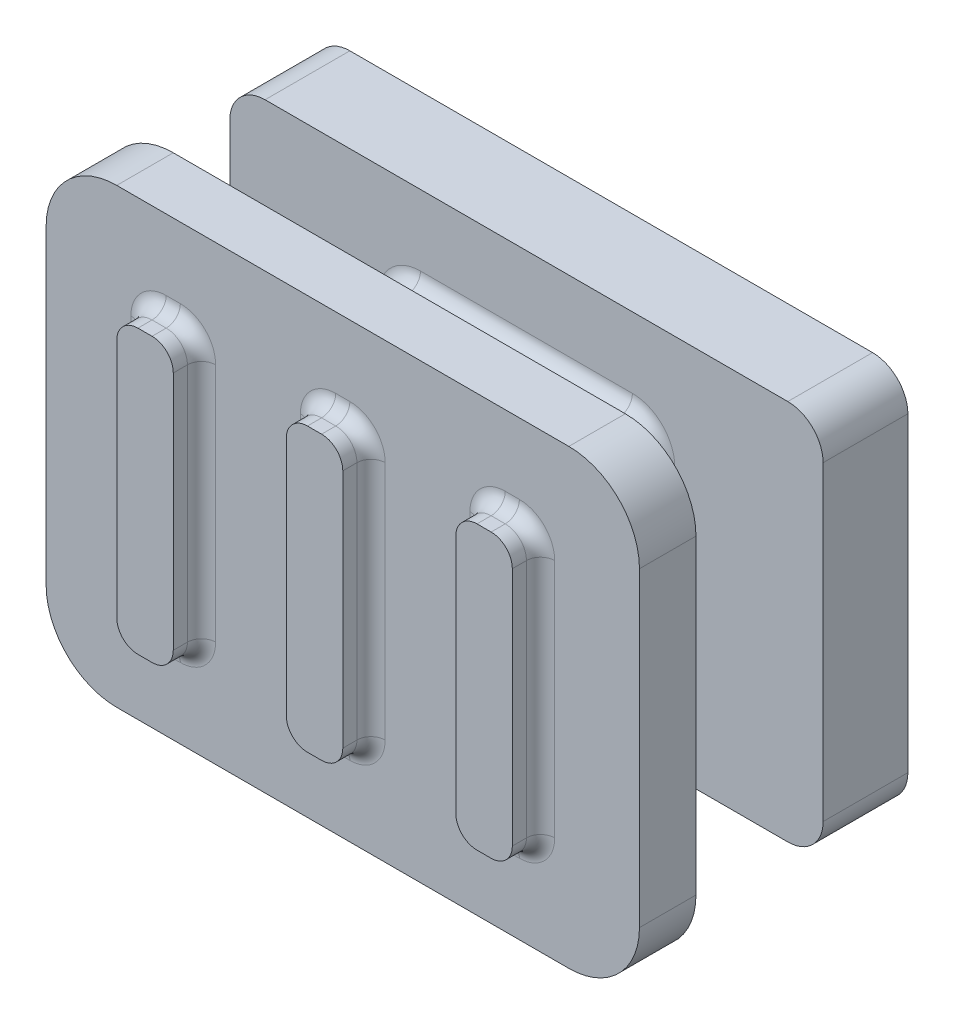
from build123d import *

# Parameters (mm, degrees)
SLIDER_STEM_DEPTH         = 4.2
CAPTIVE_FLANGE_START      = 1.2
CAPTIVE_FLANGE_DEPTH      = 1.2
THUMB_PAD_START           = 4.2
THUMB_PAD_DEPTH           = 0.8
SWITCH_PIN_SOCKET_START   = 2.3
SWITCH_PIN_SOCKET_DEPTH   = 2.4
PCB_EDGE_RELIEF_START     = 0.6
PCB_EDGE_RELIEF_PROFILE_W = 4
PCB_EDGE_RELIEF_PROFILE_H = 1.05
PCB_EDGE_RELIEF_DEPTH     = 0.7
STEM_SHOULDER_ROUND_R     = 0.2
THUMB_RIB_0_START         = 4.9
THUMB_RIB_0_DEPTH         = 0.5
THUMB_RIB_1_START         = 4.9
THUMB_RIB_1_DEPTH         = 0.5
THUMB_RIB_2_START         = 4.9
THUMB_RIB_2_DEPTH         = 0.5
THUMB_RIB_ROOT_ROUND_R    = 0.2


with BuildPart() as part:
    # Slider_stem_profile → Slider_stem (new body)
    with BuildSketch(Plane.XY):
        with BuildLine():
            Line((-1.5, -1.5), (1.5, -1.5))
            ThreePointArc((1.5, -1.5), (1.782842712, -1.382842712), (1.9, -1.1))
            Line((1.9, -1.1), (1.9, 1.1))
            ThreePointArc((1.9, 1.1), (1.782842712, 1.382842712), (1.5, 1.5))
            Line((1.5, 1.5), (-1.5, 1.5))
            ThreePointArc((-1.5, 1.5), (-1.782842712, 1.382842712), (-1.9, 1.1))
            Line((-1.9, 1.1), (-1.9, -1.1))
            ThreePointArc((-1.9, -1.1), (-1.782842712, -1.382842712), (-1.5, -1.5))
        make_face()
    extrude(amount=SLIDER_STEM_DEPTH)

    # Captive_flange_profile → Captive_flange (add)
    with BuildSketch(Plane.XY.offset(CAPTIVE_FLANGE_START)):
        with BuildLine():
            Line((-3.7, -2.7), (3.7, -2.7))
            ThreePointArc((3.7, -2.7), (4.053553391, -2.553553391), (4.2, -2.2))
            Line((4.2, -2.2), (4.2, 2.2))
            ThreePointArc((4.2, 2.2), (4.053553391, 2.553553391), (3.7, 2.7))
            Line((3.7, 2.7), (-3.7, 2.7))
            ThreePointArc((-3.7, 2.7), (-4.053553391, 2.553553391), (-4.2, 2.2))
            Line((-4.2, 2.2), (-4.2, -2.2))
            ThreePointArc((-4.2, -2.2), (-4.053553391, -2.553553391), (-3.7, -2.7))
        make_face()
    extrude(amount=CAPTIVE_FLANGE_DEPTH)

    # Thumb_pad_profile → Thumb_pad (add)
    with BuildSketch(Plane.XY.offset(THUMB_PAD_START)):
        with BuildLine():
            Line((-3.2, -3.2), (3.2, -3.2))
            ThreePointArc((3.2, -3.2), (3.907106781, -2.907106781), (4.2, -2.2))
            Line((4.2, -2.2), (4.2, 2.2))
            ThreePointArc((4.2, 2.2), (3.907106781, 2.907106781), (3.2, 3.2))
            Line((3.2, 3.2), (-3.2, 3.2))
            ThreePointArc((-3.2, 3.2), (-3.907106781, 2.907106781), (-4.2, 2.2))
            Line((-4.2, 2.2), (-4.2, -2.2))
            ThreePointArc((-4.2, -2.2), (-3.907106781, -2.907106781), (-3.2, -3.2))
        make_face()
    extrude(amount=THUMB_PAD_DEPTH)

    # Switch_pin_socket_profile → Switch_pin_socket (cut)
    with BuildSketch(Plane.XY.offset(SWITCH_PIN_SOCKET_START)):
        with BuildLine():
            Line((-0.8, -0.6), (0.8, -0.6))
            ThreePointArc((0.8, -0.6), (0.870710678, -0.570710678), (0.9, -0.5))
            Line((0.9, -0.5), (0.9, 0.5))
            ThreePointArc((0.9, 0.5), (0.870710678, 0.570710678), (0.8, 0.6))
            Line((0.8, 0.6), (-0.8, 0.6))
            ThreePointArc((-0.8, 0.6), (-0.870710678, 0.570710678), (-0.9, 0.5))
            Line((-0.9, 0.5), (-0.9, -0.5))
            ThreePointArc((-0.9, -0.5), (-0.870710678, -0.570710678), (-0.8, -0.6))
        make_face()
    extrude(amount=-SWITCH_PIN_SOCKET_DEPTH, mode=Mode.SUBTRACT)

    # PCB_edge_relief_profile → PCB_edge_relief (cut)
    with BuildSketch(Plane.XY.offset(PCB_EDGE_RELIEF_START)):
        with Locations((0, 1.075)):
            Rectangle(PCB_EDGE_RELIEF_PROFILE_W, PCB_EDGE_RELIEF_PROFILE_H)
    extrude(amount=-PCB_EDGE_RELIEF_DEPTH, mode=Mode.SUBTRACT)

    # Stem_shoulder_round
    stem_shoulder_round_edges = [part.edges().sort_by_distance(p)[0] for p in [
        (1.782842712, -1.382842712, 1.2),
        (-1.782842712, -1.382842712, 1.2),
        (-1.782842712, 1.382842712, 1.2),
        (1.782842712, 1.382842712, 1.2),
        (1.782842712, -1.382842712, 2.4),
        (-1.782842712, -1.382842712, 2.4),
        (-1.782842712, 1.382842712, 2.4),
        (1.782842712, 1.382842712, 2.4),
        (-1.782842712, -1.382842712, 4.2),
        (-1.782842712, 1.382842712, 4.2),
        (1.782842712, 1.382842712, 4.2),
        (1.782842712, -1.382842712, 4.2),
        (0, 1.5, 1.2),
        (-1.9, 0, 1.2),
        (0, -1.5, 1.2),
        (1.9, 0, 1.2),
        (0, 1.5, 2.4),
        (-1.9, 0, 2.4),
        (0, -1.5, 2.4),
        (1.9, 0, 2.4),
        (1.9, 0, 4.2),
        (0, 1.5, 4.2),
        (-1.9, 0, 4.2),
        (0, -1.5, 4.2),
    ]]
    fillet(stem_shoulder_round_edges, radius=STEM_SHOULDER_ROUND_R)

    # Thumb_rib_0_profile → Thumb_rib_0 (add)
    with BuildSketch(Plane.XY.offset(THUMB_RIB_0_START)):
        with BuildLine():
            Line((-2.5, -2), (-2.3, -2))
            ThreePointArc((-2.3, -2), (-2.087867966, -1.912132034), (-2, -1.7))
            Line((-2, -1.7), (-2, 1.7))
            ThreePointArc((-2, 1.7), (-2.087867966, 1.912132034), (-2.3, 2))
            Line((-2.3, 2), (-2.5, 2))
            ThreePointArc((-2.5, 2), (-2.712132034, 1.912132034), (-2.8, 1.7))
            Line((-2.8, 1.7), (-2.8, -1.7))
            ThreePointArc((-2.8, -1.7), (-2.712132034, -1.912132034), (-2.5, -2))
        make_face()
    extrude(amount=THUMB_RIB_0_DEPTH)

    # Thumb_rib_1_profile → Thumb_rib_1 (add)
    with BuildSketch(Plane.XY.offset(THUMB_RIB_1_START)):
        with BuildLine():
            Line((-0.1, -2), (0.1, -2))
            ThreePointArc((0.1, -2), (0.312132034, -1.912132034), (0.4, -1.7))
            Line((0.4, -1.7), (0.4, 1.7))
            ThreePointArc((0.4, 1.7), (0.312132034, 1.912132034), (0.1, 2))
            Line((0.1, 2), (-0.1, 2))
            ThreePointArc((-0.1, 2), (-0.312132034, 1.912132034), (-0.4, 1.7))
            Line((-0.4, 1.7), (-0.4, -1.7))
            ThreePointArc((-0.4, -1.7), (-0.312132034, -1.912132034), (-0.1, -2))
        make_face()
    extrude(amount=THUMB_RIB_1_DEPTH)

    # Thumb_rib_2_profile → Thumb_rib_2 (add)
    with BuildSketch(Plane.XY.offset(THUMB_RIB_2_START)):
        with BuildLine():
            Line((2.3, -2), (2.5, -2))
            ThreePointArc((2.5, -2), (2.712132034, -1.912132034), (2.8, -1.7))
            Line((2.8, -1.7), (2.8, 1.7))
            ThreePointArc((2.8, 1.7), (2.712132034, 1.912132034), (2.5, 2))
            Line((2.5, 2), (2.3, 2))
            ThreePointArc((2.3, 2), (2.087867966, 1.912132034), (2, 1.7))
            Line((2, 1.7), (2, -1.7))
            ThreePointArc((2, -1.7), (2.087867966, -1.912132034), (2.3, -2))
        make_face()
    extrude(amount=THUMB_RIB_2_DEPTH)

    # Thumb_rib_root_round
    thumb_rib_root_round_edges = [part.edges().sort_by_distance(p)[0] for p in [
        (2.087867966, -1.912132034, 5),
        (2.4, -2, 5),
        (2.712132034, -1.912132034, 5),
        (2.712132034, 1.912132034, 5),
        (2.4, 2, 5),
        (2.087867966, 1.912132034, 5),
        (-0.312132034, -1.912132034, 5),
        (0, -2, 5),
        (0.312132034, -1.912132034, 5),
        (0.312132034, 1.912132034, 5),
        (0, 2, 5),
        (-0.312132034, 1.912132034, 5),
        (-2.712132034, -1.912132034, 5),
        (-2.4, -2, 5),
        (-2.087867966, -1.912132034, 5),
        (-2.087867966, 1.912132034, 5),
        (-2.4, 2, 5),
        (-2.712132034, 1.912132034, 5),
        (2.8, 0, 5),
        (2, 0, 5),
        (0.4, 0, 5),
        (-0.4, 0, 5),
        (-2, 0, 5),
        (-2.8, 0, 5),
    ]]
    fillet(thumb_rib_root_round_edges, radius=THUMB_RIB_ROOT_ROUND_R)


solid = part.part
